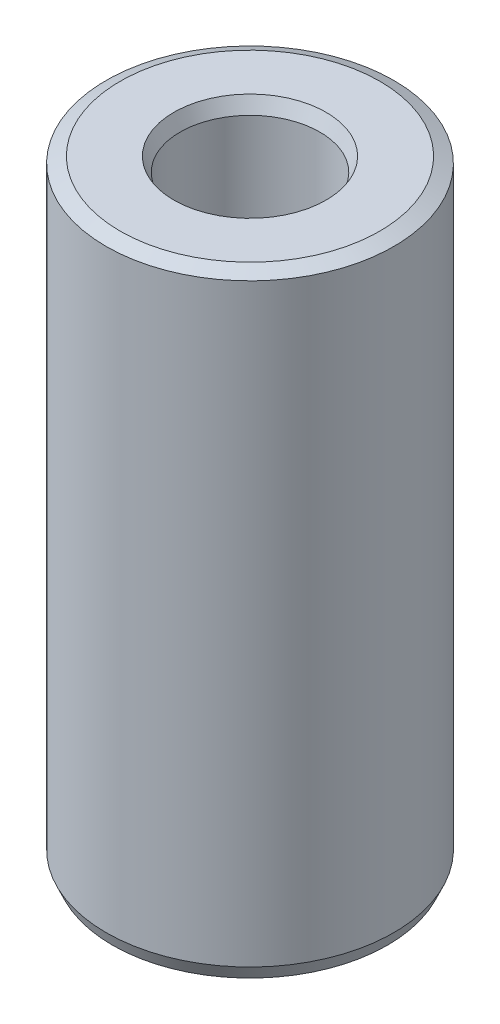
from build123d import *
from OCP.BRepFilletAPI import BRepFilletAPI_MakeChamfer

# Parameters (mm, degrees)
SKETCH1_R           = 32.5
BOSS_EXTRUDE1_DEPTH = 138.841651171
SKETCH2_R           = 15.786396994
CUT_EXTRUDE1_DEPTH  = 147.251509735
CHAMFER1_SIZE       = 1.415521092
CHAMFER1_SIZE2      = 3.163702985


with BuildPart() as part:
    # Sketch1 → Boss-Extrude1 (new body)
    with BuildSketch(Plane(origin=(0, 0, 0), x_dir=(1, 0, 0), z_dir=(0, 1, 0))):
        Circle(SKETCH1_R)
    extrude(amount=BOSS_EXTRUDE1_DEPTH)

    # Sketch2 → Cut-Extrude1 (cut, through all)
    with BuildSketch(Plane(origin=(0, 0, 0), x_dir=(1, 0, 0), z_dir=(0, 1, 0))):
        Circle(SKETCH2_R)
    extrude(amount=CUT_EXTRUDE1_DEPTH, mode=Mode.SUBTRACT)

    # Chamfer1: one chamfer whose edges measure the first distance from different faces: ONE call of the kernel's chamfer builder (chamfer() names one face for all edges)
    chamfer1_edges_1 = [part.edges().sort_by_distance(p)[0] for p in [
        (-15.786396994, 138.841651171, 0),
    ]]
    chamfer1_side_1 = [part.faces().sort_by_distance(p)[0] for p in [
        (-31.580761184, 138.841651171, 0),
    ]]
    chamfer1_edges_2 = [part.edges().sort_by_distance(p)[0] for p in [
        (-15.786396994, 0, 0),
    ]]
    chamfer1_side_2 = [part.faces().sort_by_distance(p)[0] for p in [
        (-15.786396994, 69.420825586, 0),
    ]]
    chamfer1_edges_3 = [part.edges().sort_by_distance(p)[0] for p in [
        (-32.5, 0, 0),
    ]]
    chamfer1_side_3 = [part.faces().sort_by_distance(p)[0] for p in [
        (-31.580761184, 0, 0),
    ]]
    chamfer1_edges_4 = [part.edges().sort_by_distance(p)[0] for p in [
        (-32.5, 138.841651171, 0),
    ]]
    chamfer1_side_4 = [part.faces().sort_by_distance(p)[0] for p in [
        (-32.5, 69.420825586, 0),
    ]]
    chamfer1 = BRepFilletAPI_MakeChamfer(part.part.solid().wrapped)
    for e in chamfer1_edges_1:
        chamfer1.Add(CHAMFER1_SIZE, CHAMFER1_SIZE2, e.wrapped, chamfer1_side_1[0].wrapped)  # the first distance lies on this face
    for e in chamfer1_edges_2:
        chamfer1.Add(CHAMFER1_SIZE, CHAMFER1_SIZE2, e.wrapped, chamfer1_side_2[0].wrapped)  # the first distance lies on this face
    for e in chamfer1_edges_3:
        chamfer1.Add(CHAMFER1_SIZE, CHAMFER1_SIZE2, e.wrapped, chamfer1_side_3[0].wrapped)  # the first distance lies on this face
    for e in chamfer1_edges_4:
        chamfer1.Add(CHAMFER1_SIZE, CHAMFER1_SIZE2, e.wrapped, chamfer1_side_4[0].wrapped)  # the first distance lies on this face
    add(Compound.cast(chamfer1.Shape()), mode=Mode.REPLACE)


solid = part.part
